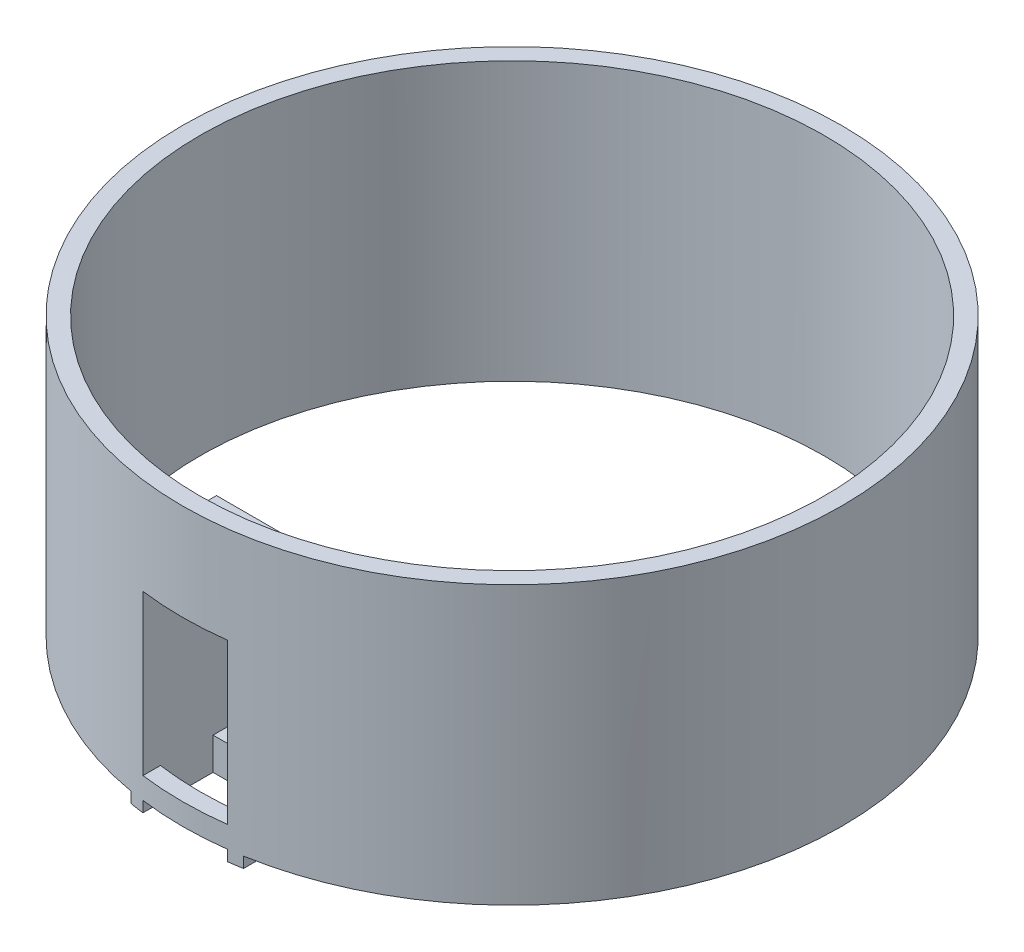
from build123d import *

# Parameters (mm, degrees)
SKETCH1_R                = 47.5
SKETCH1_R_2              = 45
EXTRUDE_THIN1_DEPTH      = 20
BOSS_EXTRUDE1_REACH      = 98.852
BOSS_EXTRUDE1_END_RADIUS = 47.5
SKETCH2_W                = 2
SKETCH2_H                = 32.3
SKETCH3_W                = 12.2
SKETCH3_H                = 4.65
SKETCH3_R                = 1.1
BOSS_EXTRUDE2_DEPTH      = 2.5
SKETCH4_W                = 12.2
SKETCH4_H                = 23
CUT_EXTRUDE1_DEPTH       = 98.183602012


with BuildPart() as part:
    # Sketch1 → Extrude-Thin1 (new, symmetric)
    with BuildSketch(Plane(origin=(0, 0, 0), x_dir=(1, 0, 0), z_dir=(0, 1, 0))):
        Circle(SKETCH1_R)
        Circle(SKETCH1_R_2, mode=Mode.SUBTRACT)
    extrude(amount=EXTRUDE_THIN1_DEPTH, both=True)

    # Boss-Extrude1: up to this cylinder (the profile starts inside it)
    boss_extrude1_end = Plane(origin=(0, -5.4, 0), z_dir=(0, -1, 0)) * Cylinder(BOSS_EXTRUDE1_END_RADIUS, 293.704, mode=Mode.PRIVATE)
    # Sketch2 → Boss-Extrude1 (add, up to the surface)
    with BuildSketch(Plane.XY.offset(34.5), mode=Mode.PRIVATE) as boss_extrude1_sk1:
        with Locations((-7.1, -5.4)):
            Rectangle(SKETCH2_W, SKETCH2_H)
    boss_extrude1_tool1 = extrude(boss_extrude1_sk1.sketch, amount=BOSS_EXTRUDE1_REACH, mode=Mode.PRIVATE) & boss_extrude1_end
    add(boss_extrude1_tool1.solids().sort_by_distance((-7.1, -5.4, 34.5))[0])
    # Sketch2 → Boss-Extrude1 (add, up to the surface)
    with BuildSketch(Plane.XY.offset(34.5), mode=Mode.PRIVATE) as boss_extrude1_sk2:
        with Locations((7.1, -5.4)):
            Rectangle(SKETCH2_W, SKETCH2_H)
    boss_extrude1_tool2 = extrude(boss_extrude1_sk2.sketch, amount=BOSS_EXTRUDE1_REACH, mode=Mode.PRIVATE) & boss_extrude1_end
    add(boss_extrude1_tool2.solids().sort_by_distance((7.1, -5.4, 34.5))[0])

    # Sketch3 → Boss-Extrude2 (add)
    # profile 1 of 2: a face of its own
    with BuildSketch(Plane.XY.offset(34.5)):
        with Locations((0, -19.225)):
            Rectangle(SKETCH3_W, SKETCH3_H)
        with Locations((0, -19.55)):
            Circle(SKETCH3_R, mode=Mode.SUBTRACT)
    # profile 2 of 2: a face of its own
    with BuildSketch(Plane.XY.offset(34.5)):
        with Locations((0, 8.425)):
            Rectangle(SKETCH3_W, SKETCH3_H)
        with Locations((0, 8.75)):
            Circle(SKETCH3_R, mode=Mode.SUBTRACT)
    extrude(amount=BOSS_EXTRUDE2_DEPTH)

    # Sketch4 → Cut-Extrude1 (cut, through all)
    with BuildSketch(Plane.XY.offset(34.5)):
        with Locations((0, -5.4)):
            Rectangle(SKETCH4_W, SKETCH4_H)
    extrude(amount=CUT_EXTRUDE1_DEPTH, mode=Mode.SUBTRACT)


solid = part.part
